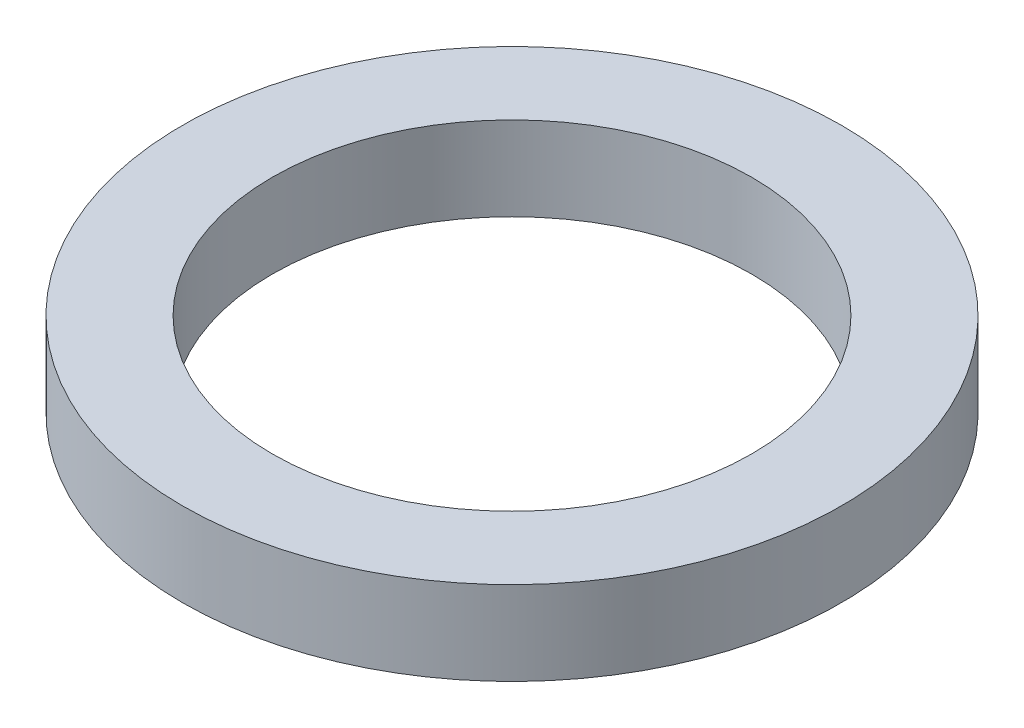
from build123d import *

# Parameters (mm, degrees)
SKETCH1_R           = 55
BOSS_EXTRUDE1_DEPTH = 14
SKETCH2_R           = 40
CUT_EXTRUDE1_DEPTH  = 80.031639234


with BuildPart() as part:
    # Sketch1 → Boss-Extrude1 (new body)
    with BuildSketch(Plane(origin=(0, 0, 0), x_dir=(1, 0, 0), z_dir=(0, 1, 0))):
        Circle(SKETCH1_R)
    extrude(amount=BOSS_EXTRUDE1_DEPTH)

    # Sketch2 → Cut-Extrude1 (cut, through all)
    with BuildSketch(Plane(origin=(0, 0, 0), x_dir=(1, 0, 0), z_dir=(0, 1, 0))):
        Circle(SKETCH2_R)
    extrude(amount=CUT_EXTRUDE1_DEPTH, mode=Mode.SUBTRACT)


solid = part.part
